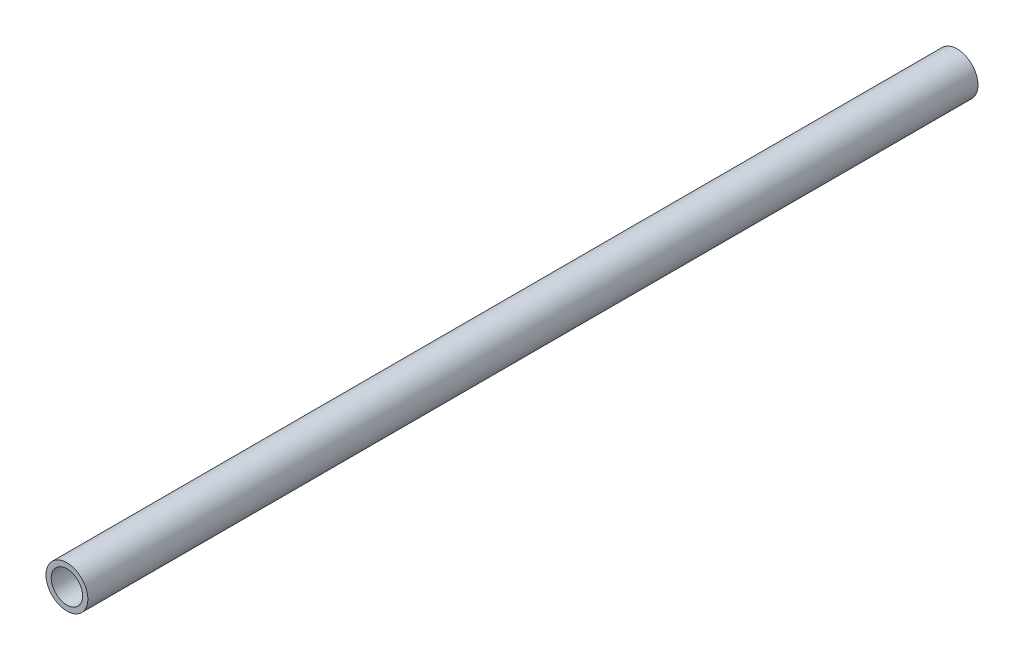
from build123d import *

# Parameters (mm, degrees)
SKETCH2_R           = 12.7
SKETCH2_R_2         = 9.525
BOSS_EXTRUDE1_DEPTH = 269.89405


with BuildPart() as part:
    # Sketch2 → Boss-Extrude1 (new, symmetric)
    with BuildSketch(Plane.XY):
        Circle(SKETCH2_R)
        Circle(SKETCH2_R_2, mode=Mode.SUBTRACT)
    extrude(amount=BOSS_EXTRUDE1_DEPTH, both=True)


solid = part.part
